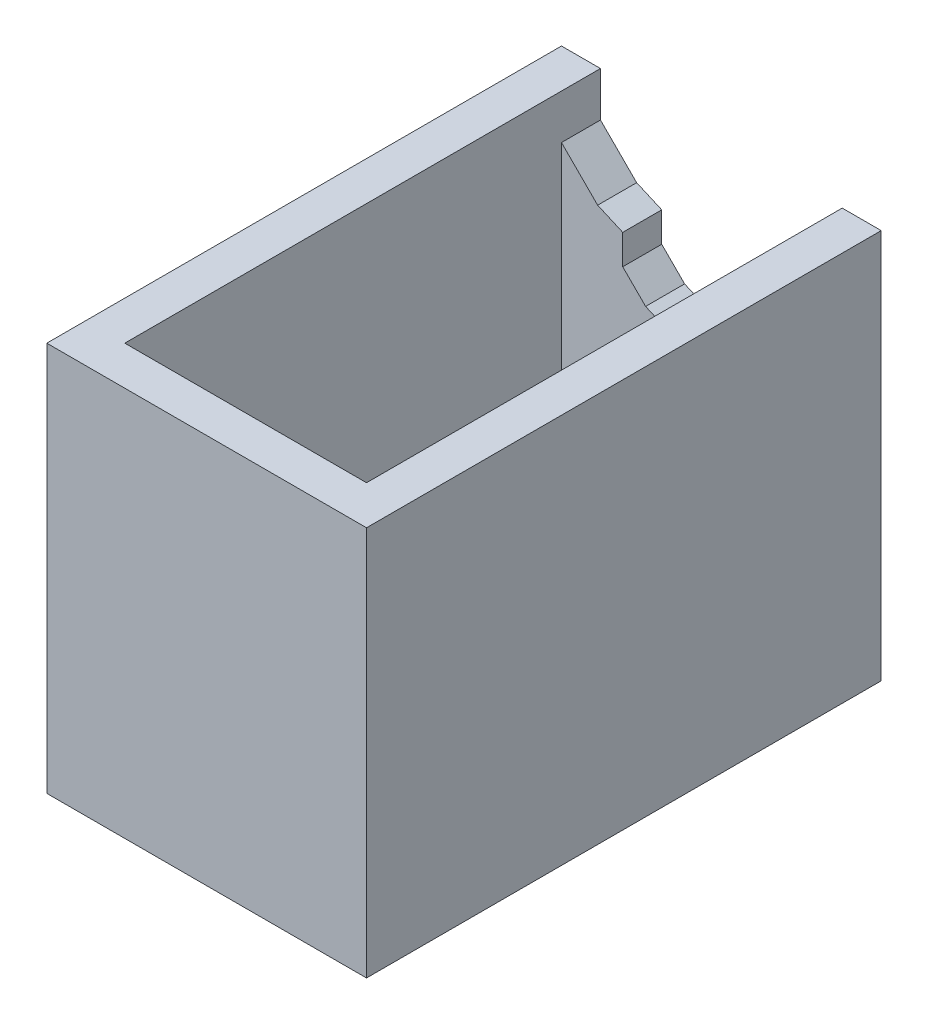
from build123d import *

# Parameters (mm, degrees)
SKETCH1_W           = 16.4
SKETCH1_H           = 26.4
SKETCH1_W_2         = 12.4
SKETCH1_H_2         = 22.4
BOSS_EXTRUDE1_DEPTH = 20
CUT_EXTRUDE1_DEPTH  = 10


with BuildPart() as part:
    # Sketch1 → Boss-Extrude1 (new body)
    with BuildSketch(Plane(origin=(0, 0, 0), x_dir=(1, 0, 0), z_dir=(0, 1, 0))):
        with Locations((6.2, 11.2)):
            Rectangle(SKETCH1_W, SKETCH1_H)
        with Locations((6.2, 11.2)):
            Rectangle(SKETCH1_W_2, SKETCH1_H_2, mode=Mode.SUBTRACT)
    extrude(amount=BOSS_EXTRUDE1_DEPTH)

    # Sketch2 → Cut-Extrude1 (cut)
    with BuildSketch(Plane(origin=(0, 0, -24.4), x_dir=(-1, 0, 0), z_dir=(0, 0, -1))):
        Polygon((-12.4, 20), (-12.4, 17.712061235), (-10.544532553, 15.856593788), (-9.258136531, 15.293507674), (-9.258136531, 13.764128217), (-8.084426715, 12.5904184), (-6.2, 11.765560038), (-4.315573285, 12.5904184), (-3.141863469, 13.764128217), (-3.141863469, 15.293507674), (-1.855467447, 15.856593788), (0, 17.712061235), (0, 20), align=None)
    extrude(amount=-CUT_EXTRUDE1_DEPTH, mode=Mode.SUBTRACT)


solid = part.part
